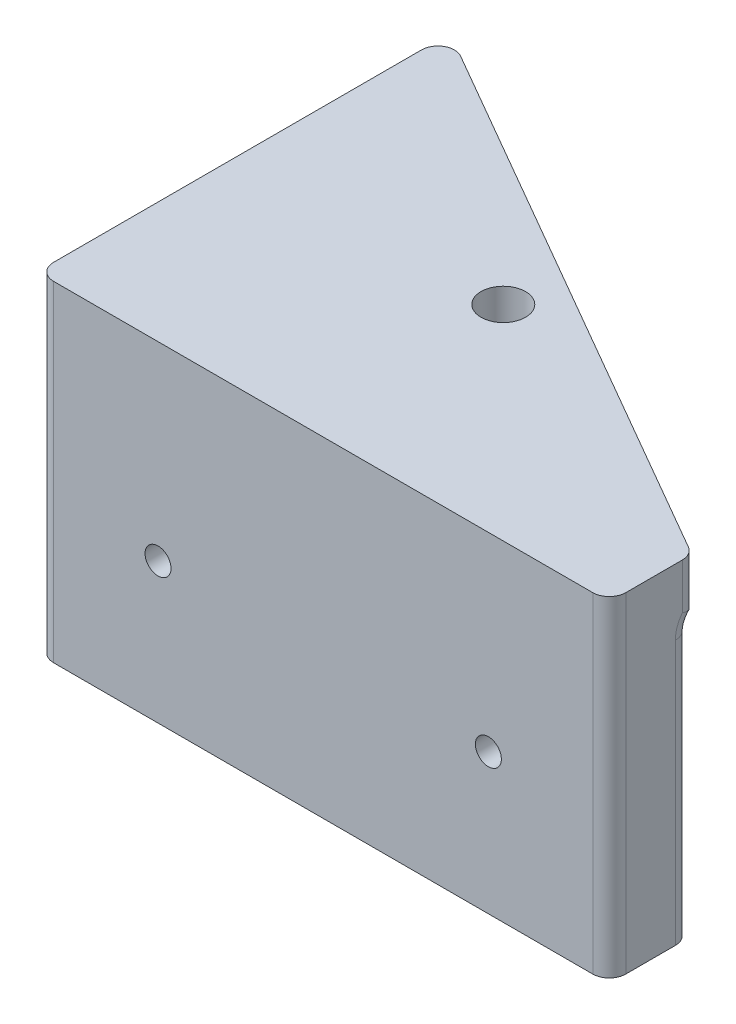
from build123d import *

# Parameters (mm, degrees)
SKETCH1_R           = 3.429
BOSS_EXTRUDE1_DEPTH = 50.8
SKETCH2_W           = 50.8
SKETCH2_H           = 43.18
CUT_EXTRUDE1_DEPTH  = 120.811560377
SKETCH3_R           = 2
CUT_EXTRUDE2_DEPTH  = 114.592253257
FILLET1_START       = -1
FILLET1_DEPTH       = 41.6399999
FILLET1_START_2     = 4.794504
FILLET1_2_DEPTH     = 47.205496
FILLET1_START_3     = 40.6399999
FILLET1_3_DEPTH     = 2.5400001
FILLET1_START_4     = -61.640591048
FILLET1_5_DEPTH     = 46.400591048


with BuildPart() as part:
    # Sketch1 → Boss-Extrude1 (new body)
    with BuildSketch(Plane(origin=(0, 0, 0), x_dir=(1, 0, 0), z_dir=(0, 1, 0))):
        Polygon((0, 0), (87.988181024, 0), (87.988181024, 12.7), (0, 63.5), align=None)
        with Locations(Location((40.184090512, 31.500886423, 0), (0, 0, 270))):
            Circle(SKETCH1_R, mode=Mode.SUBTRACT)
    extrude(amount=BOSS_EXTRUDE1_DEPTH)

    # Sketch2 → Cut-Extrude1 (cut, through all)
    with BuildSketch(Plane(origin=(87.988181024, 0, 0), x_dir=(0, 0, -1), z_dir=(1, 0, 0))):
        with Locations((38.1, 21.59)):
            Rectangle(SKETCH2_W, SKETCH2_H)
    extrude(amount=-CUT_EXTRUDE1_DEPTH, mode=Mode.SUBTRACT)

    # Sketch3 → Cut-Extrude2 (cut, through all)
    with BuildSketch(Plane(origin=(0, 0, -12.7), x_dir=(-1, 0, 0), z_dir=(0, 0, -1))):
        with Locations((-69.394090512, 21.59)):
            Circle(SKETCH3_R)
        with Locations((-18.594090512, 21.59)):
            Circle(SKETCH3_R)
    extrude(amount=-CUT_EXTRUDE2_DEPTH, mode=Mode.SUBTRACT)

    # Fillet1: read off the stored shape, not the designer's step
    # Fillet1 outline → Fillet1 (cut)
    with BuildSketch(Plane(origin=(0, 0, 0), x_dir=(1, 0, 0), z_dir=(0, 1, 0)).offset(FILLET1_START)):
        with BuildLine():
            ThreePointArc((85.448181024, 12.7), (87.244232248, 11.956051225), (87.988181024, 10.16))
            Line((87.988181024, 10.16), (87.988181024, 12.7))
            Line((87.988181024, 12.7), (85.448181024, 12.7))
        make_face()
        with BuildLine():
            ThreePointArc((0, 10.16), (0.743948776, 11.956051224), (2.54, 12.7))
            Line((2.54, 12.7), (0, 12.7))
            Line((0, 12.7), (0, 10.16))
        make_face()
        with BuildLine():
            Line((87.988181024, 0), (87.988181024, 2.54))
            ThreePointArc((87.988181024, 2.54), (87.244232248, 0.743948775), (85.448181024, 0))
            Line((85.448181024, 0), (87.988181024, 0))
        make_face()
        with BuildLine():
            ThreePointArc((2.54, 0), (0.743948776, 0.743948776), (0, 2.54))
            Line((0, 2.54), (0, 0))
            Line((0, 0), (2.54, 0))
        make_face()
    extrude(amount=FILLET1_DEPTH, mode=Mode.SUBTRACT)

    # Fillet1 2 outline → Fillet1 2 (cut)
    with BuildSketch(Plane(origin=(0, 0, 0), x_dir=(1, 0, 0), z_dir=(0, 1, 0)).offset(FILLET1_START_2)):
        with BuildLine():
            Line((87.988181024, 11.233530316), (87.988181024, 12.7))
            Line((87.988181024, 12.7), (86.718181024, 13.433234842))
            ThreePointArc((86.718181024, 13.433234842), (87.64788555, 12.503530316), (87.988181024, 11.233530316))
        make_face()
        with BuildLine():
            Line((87.988181024, 0), (87.988181024, 2.54))
            ThreePointArc((87.988181024, 2.54), (87.244232248, 0.743948775), (85.448181024, 0))
            Line((85.448181024, 0), (87.988181024, 0))
        make_face()
        with BuildLine():
            ThreePointArc((2.54, 0), (0.743948776, 0.743948776), (0, 2.54))
            Line((0, 2.54), (0, 0))
            Line((0, 0), (2.54, 0))
        make_face()
        with BuildLine():
            Line((0, 63.5), (0, 59.100590949))
            ThreePointArc((0, 59.100590949), (1.27, 61.300295474), (3.81, 61.300295474))
            Line((3.81, 61.300295474), (0, 63.5))
        make_face()
    extrude(amount=FILLET1_2_DEPTH, mode=Mode.SUBTRACT)

    # Fillet1 3 outline → Fillet1 3 (add)
    with BuildSketch(Plane(origin=(0, 0, 0), x_dir=(1, 0, 0), z_dir=(0, 1, 0)).offset(FILLET1_START_3)):
        with BuildLine():
            Line((0, 12.7), (87.52208234, 12.7))
            ThreePointArc((87.52208234, 12.7), (87.159854864, 13.110168978), (86.718181024, 13.433234842))
            Line((86.718181024, 13.433234842), (3.81, 61.300295474))
            ThreePointArc((3.81, 61.300295474), (1.27, 61.300295474), (0, 59.100590949))
            Line((0, 59.100590949), (0, 12.7))
        make_face()
    extrude(amount=FILLET1_3_DEPTH)

    # Fillet1 4 outline → Fillet1 4 (revolve, cut)
    with BuildSketch(Plane(origin=(0, 40.64, -15.24), x_dir=(0, 1, 0), z_dir=(0, 0, -1))):
        with BuildLine():
            Line((5.08, 87.988181024), (0, 87.988181024))
            Line((0, 87.988181024), (0, 0))
            Line((0, 0), (5.08, 0))
            ThreePointArc((5.08, 0), (3.283948776, 0.743948776), (2.54, 2.54))
            Line((2.54, 2.54), (2.54, 85.448181024))
            ThreePointArc((2.54, 85.448181024), (3.283948775, 87.244232248), (5.08, 87.988181024))
        make_face()
    revolve(axis=Axis((0, 40.64, -15.24), (1, 0, 0)), mode=Mode.SUBTRACT)

    # Fillet1 5 outline → Fillet1 5 (cut)
    with BuildSketch(Plane.XY.offset(FILLET1_START_4)):
        with BuildLine():
            Line((85, 43.18), (2.54, 43.18))
            ThreePointArc((2.54, 43.18), (0.743948776, 43.923948776), (0, 45.72))
            Line((0, 45.72), (0, 40.6399999))
            Line((0, 40.6399999), (85, 40.6399999))
            Line((85, 40.6399999), (85, 43.18))
        make_face()
    extrude(amount=FILLET1_5_DEPTH, mode=Mode.SUBTRACT)


solid = part.part
